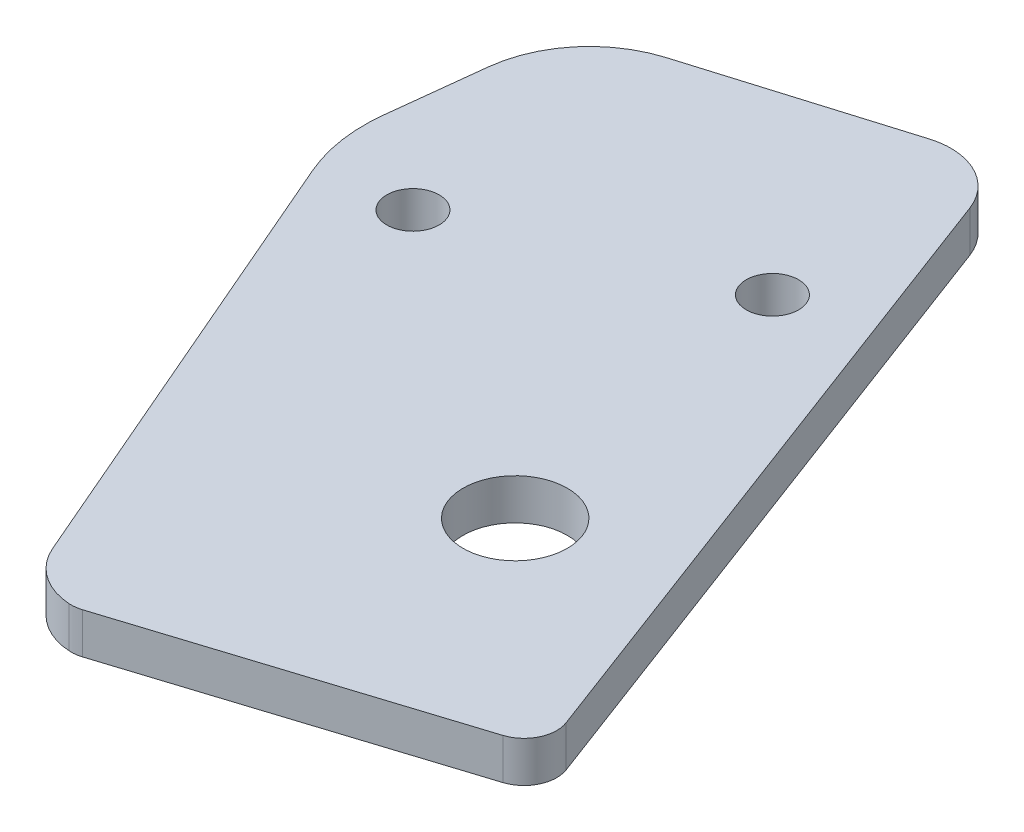
from build123d import *

# Parameters (mm, degrees)
BOSS_EXTRUDE1_DEPTH = 3.175
SKETCH2_R           = 2.032
BOSS_EXTRUDE2_DEPTH = 3.175
SKETCH2_3_R         = 4.05
CUT_EXTRUDE1_DEPTH  = 63.201892938
FILLET1_R           = 2.54


with BuildPart() as part:
    # Sketch1 → Boss-Extrude1 (new body)
    with BuildSketch(Plane(origin=(0, 0, 0), x_dir=(1, 0, 0), z_dir=(0, 1, 0))):
        Polygon((25.4, -6.35), (12.7, -6.35), (12.7, 19.05), (-12.7, 19.05), (-12.7, -19.05), (25.4, -19.05), align=None)
    extrude(amount=BOSS_EXTRUDE1_DEPTH)

    # Sketch2 → Boss-Extrude2 (add)
    # profile 1 of 2: a face of its own
    with BuildSketch(Plane.XZ):
        Polygon((12.7, 1.472649747), (13.949167892, 4.789594929), (12.7, 5.186439946), align=None)
    # profile 2 of 2: a face of its own
    with BuildSketch(Plane.XZ):
        with BuildLine():
            Line((-12.7, 13.255702289), (-13.373056837, 13.469524029))
            ThreePointArc((-13.373056837, 13.469524029), (-13.831582673, 13.569694165), (-14.300710901, 13.583790422))
            ThreePointArc((-14.300710901, 13.583790422), (-16.90590193, 12.668940106), (-18.647730427, 10.526510437))
            Line((-18.647730427, 10.526510437), (-33.997782473, -25.04377908))
            ThreePointArc((-33.997782473, -25.04377908), (-34.900150323, -28.214966504), (-34.955795775, -31.511570969))
            Line((-34.955795775, -31.511570969), (-34.123437377, -38.826910048))
            ThreePointArc((-34.123437377, -38.826910048), (-32.117046877, -43.516551498), (-27.863250656, -46.331432931))
            Line((-27.863250656, -46.331432931), (-12.15852304, -51.079668538))
            ThreePointArc((-12.15852304, -51.079668538), (-8.439878849, -50.772366449), (-5.934296975, -48.007441738))
            Line((-5.934296975, -48.007441738), (-0.611549336, -33.873823471))
            Line((-0.611549336, -33.873823471), (4.971130901, -19.05))
            Line((4.971130901, -19.05), (-12.7, -19.05))
            Line((-12.7, -19.05), (-12.7, 8.957831881))
            Line((-12.7, 8.957831881), (-12.7, 13.255702289))
        make_face()
        with Locations((-27.434824274, -26.25669415)):
            Circle(SKETCH2_R, mode=Mode.SUBTRACT)
        with Locations((-7.764936406, -34.507055205)):
            Circle(SKETCH2_R, mode=Mode.SUBTRACT)
    extrude(amount=-BOSS_EXTRUDE2_DEPTH)

    # Sketch2<3> → Cut-Extrude1 (cut, through all)
    with BuildSketch(Plane.XZ):
        Polygon((-12.7, 13.255702289), (12.7, 5.186439946), (12.7, 6.35), (25.4, 6.35), (25.4, 19.05), (-12.7, 19.05), align=None)
        Polygon((12.7, -19.05), (12.7, 1.472649747), (4.971130901, -19.05), align=None)
        with Locations((-2.723911437, -9.485123164)):
            Circle(SKETCH2_3_R)
    extrude(amount=-CUT_EXTRUDE1_DEPTH, mode=Mode.SUBTRACT)

    # Fillet1
    fillet1_edges = [part.edges().sort_by_distance(p)[0] for p in [
        (13.949167892, 1.5875, 4.789594929),
    ]]
    fillet(fillet1_edges, radius=FILLET1_R)


solid = part.part
